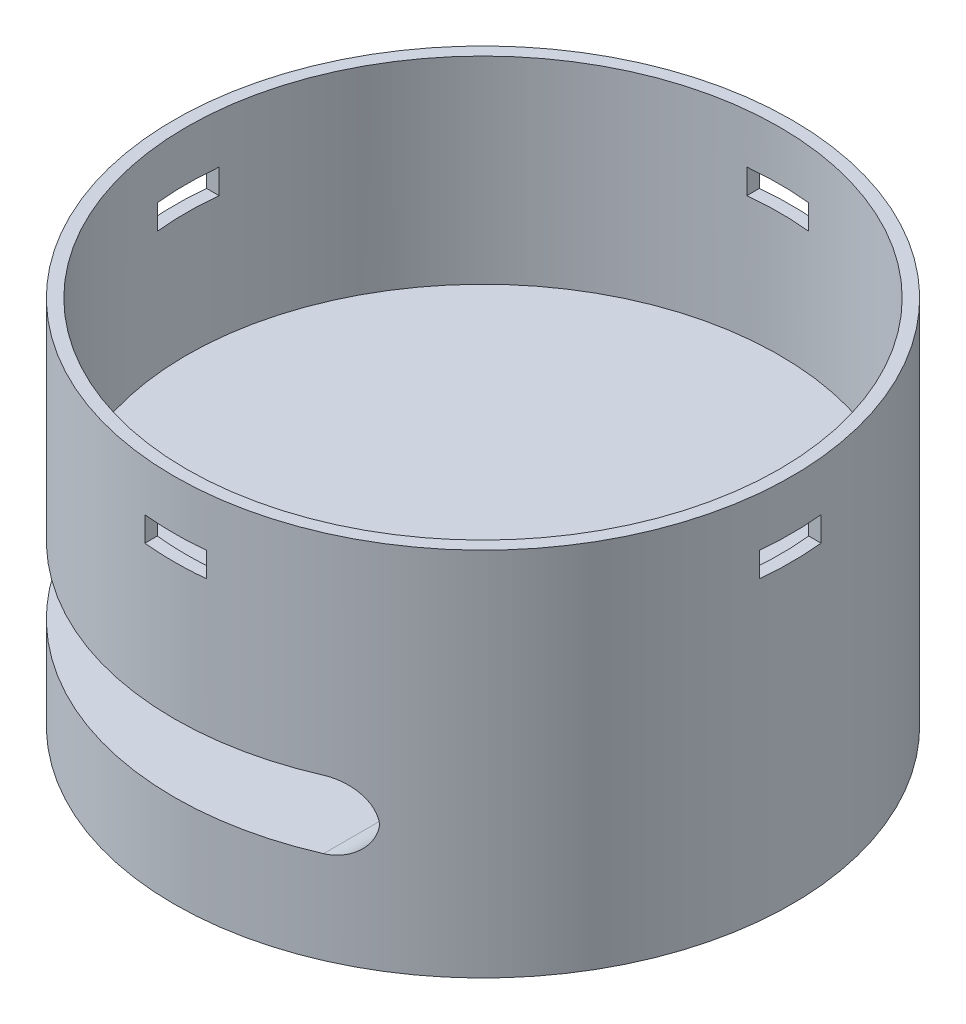
from build123d import *

# Parameters (mm, degrees)
SKETCH2_R                      = 250
BOSS_EXTRUDE1_DEPTH            = 300
CUT_EXTRUDE1_DEPTH             = 464.680924775
CUT_EXTRUDE1_DEPTH_BACK        = 464.680924775
SKETCH3_W                      = 380
SKETCH3_H                      = 55
SHELL1_START                   = 140
SHELL1_OUTLINE_R               = 240
SHELL1_DEPTH                   = 150
SHELL1_START_2                 = 10
SHELL1_2_OUTLINE_R             = 240
SHELL1_2_DEPTH                 = 55
SHELL1_START_3                 = 65
SHELL1_3_DEPTH                 = 75
CUT_EXTRUDE2_REACH             = 546.885
SKETCH4_W                      = 120
SKETCH4_H                      = 20
CUT_EXTRUDE5_START             = -20
SKETCH6_R                      = 240
CUT_EXTRUDE5_DEPTH             = 20
CUT_EXTRUDE6_REACH             = 465.681
SKETCH8_3_W                    = 50
SKETCH8_3_H                    = 20
CUT_EXTRUDE6_DIRECTION_2_DEPTH = 464.680924775
CIRPATTERN1_COUNT              = 2
CIRPATTERN1_ANGLE              = 90
FILLET2_R                      = 30


# Read off the part's stored shape, not the designer's step: Shell1
with BuildPart() as part:
    # Sketch2 → Boss-Extrude1 (new body)
    with BuildSketch(Plane(origin=(0, 0, 0), x_dir=(1, 0, 0), z_dir=(0, 1, 0))):
        with Locations(Location((0, 0, 0), (0, 0, 270))):
            Circle(SKETCH2_R)
    extrude(amount=BOSS_EXTRUDE1_DEPTH)

    # Sketch3 → Cut-Extrude1 (cut, two sides: drawn at the far end of the back side and taken through both)
    with BuildSketch(Plane.XY.offset(-CUT_EXTRUDE1_DEPTH_BACK)):
        with Locations((-60, 102.5)):
            Rectangle(SKETCH3_W, SKETCH3_H)
    extrude(amount=CUT_EXTRUDE1_DEPTH + CUT_EXTRUDE1_DEPTH_BACK, mode=Mode.SUBTRACT)

    # Shell1 outline → Shell1 (cut)
    with BuildSketch(Plane(origin=(0, 0, 0), x_dir=(1, 0, 0), z_dir=(0, 1, 0)).offset(SHELL1_START)):
        Circle(SHELL1_OUTLINE_R)
    extrude(amount=SHELL1_DEPTH, mode=Mode.SUBTRACT)

    # Shell1 2 outline → Shell1 2 (cut)
    with BuildSketch(Plane(origin=(0, 0, 0), x_dir=(1, 0, 0), z_dir=(0, 1, 0)).offset(SHELL1_START_2)):
        Circle(SHELL1_2_OUTLINE_R)
    extrude(amount=SHELL1_2_DEPTH, mode=Mode.SUBTRACT)

    # Shell1 3 outline → Shell1 3 (cut)
    with BuildSketch(Plane(origin=(0, 0, 0), x_dir=(1, 0, 0), z_dir=(0, 1, 0)).offset(SHELL1_START_3)):
        with BuildLine():
            ThreePointArc((140, -194.935886896), (240, 0), (140, 194.935886896))
            Line((140, 194.935886896), (140, -194.935886896))
        make_face()
    extrude(amount=SHELL1_3_DEPTH, mode=Mode.SUBTRACT)

    # Sketch4 → Cut-Extrude2 (cut, up to next)
    with BuildSketch(Plane.ZY.offset(-130), mode=Mode.PRIVATE) as cut_extrude2_sk1:
        with Locations((0, 102.5)):
            Rectangle(SKETCH4_W, SKETCH4_H)
    cut_extrude2_tool1 = extrude(cut_extrude2_sk1.sketch, amount=-CUT_EXTRUDE2_REACH, mode=Mode.PRIVATE) & part.part
    add(cut_extrude2_tool1.solids().sort_by_distance((130, 102.5, 0))[0], mode=Mode.SUBTRACT)

    # Sketch6 → Cut-Extrude5 (cut)
    with BuildSketch(Plane(origin=(0, 300, 0), x_dir=(1, 0, 0), z_dir=(0, 1, 0)).offset(CUT_EXTRUDE5_START)):
        with Locations(Location((0, 0, 0), (0, 0, 270))):
            Circle(SKETCH6_R)
    extrude(amount=CUT_EXTRUDE5_DEPTH, mode=Mode.SUBTRACT)

    # Sketch8<3> → Cut-Extrude6 (cut, up to next)
    with BuildSketch(Plane(origin=(0, 0, 0), x_dir=(0, 0, -1), z_dir=(1, 0, 0)), mode=Mode.PRIVATE) as cut_extrude6_sk1:
        with Locations((0, 250)):
            Rectangle(SKETCH8_3_W, SKETCH8_3_H)
    cut_extrude6_tool1 = extrude(cut_extrude6_sk1.sketch, amount=-CUT_EXTRUDE6_REACH, mode=Mode.PRIVATE) & part.part
    cut_extrude6 = cut_extrude6_tool1.solids().sort_by_distance((0, 250, 0))[0]
    add(cut_extrude6, mode=Mode.SUBTRACT)

    # Sketch8<3> → Cut-Extrude6 direction 2 (cut)
    with BuildSketch(Plane(origin=(0, 0, 0), x_dir=(0, 0, -1), z_dir=(1, 0, 0))):
        with Locations((0, 250)):
            Rectangle(SKETCH8_3_W, SKETCH8_3_H)
    cut_extrude6_direction_2 = extrude(amount=CUT_EXTRUDE6_DIRECTION_2_DEPTH, mode=Mode.SUBTRACT)

    # CirPattern1: Cut-Extrude6, Cut-Extrude6 direction 2 ×2 about axis
    cirpattern1_axis = Axis((0, 300, 0), (0, 1, 0))
    add([cut_extrude6.rotate(cirpattern1_axis, i * CIRPATTERN1_ANGLE / (CIRPATTERN1_COUNT - 1)) for i in range(1, CIRPATTERN1_COUNT)], mode=Mode.SUBTRACT)
    add([cut_extrude6_direction_2.rotate(cirpattern1_axis, i * CIRPATTERN1_ANGLE / (CIRPATTERN1_COUNT - 1)) for i in range(1, CIRPATTERN1_COUNT)], mode=Mode.SUBTRACT)

    # Fillet2
    # the kernel refuses this fillet: 30 mm, written as the material it adds along each edge
    with BuildSketch(Plane(origin=(130, 130, -288.541565041), x_dir=(0, -1, 0), z_dir=(0, 0, 1))) as fillet2_piece_1_section:
        with BuildLine():
            CenterArc((FILLET2_R, -FILLET2_R), FILLET2_R, 90, 90)
            Line((0, -FILLET2_R), (0, 0))
            Line((0, 0), (FILLET2_R, 0))
        make_face()
    fillet2_piece_1 = extrude(amount=577.083130081, mode=Mode.PRIVATE)
    fillet2_piece_1 = fillet2_piece_1 & Plane(origin=(0, 108.141191738, 0), x_dir=(0, 0, 1), z_dir=(0, -1, 0)) * Cylinder(250, 1275, mode=Mode.PRIVATE)
    fillet2_piece_1 = split(fillet2_piece_1, bisect_by=Plane(origin=(129.633192853, 108.141191738, -60), z_dir=(0, 0, -1)), keep=Keep.TOP, mode=Mode.PRIVATE)
    fillet2_piece_1 = split(fillet2_piece_1, bisect_by=Plane(origin=(129.633192853, 112.5, -136.881350588), z_dir=(0, -1, 0)), keep=Keep.TOP, mode=Mode.PRIVATE)
    add(fillet2_piece_1)
    with BuildSketch(Plane(origin=(130, 130, -288.541565041), x_dir=(0, -1, 0), z_dir=(0, 0, 1))) as fillet2_piece_2_section:
        with BuildLine():
            CenterArc((FILLET2_R, -FILLET2_R), FILLET2_R, 90, 90)
            Line((0, -FILLET2_R), (0, 0))
            Line((0, 0), (FILLET2_R, 0))
        make_face()
    fillet2_piece_2 = extrude(amount=577.083130081, mode=Mode.PRIVATE)
    fillet2_piece_2 = fillet2_piece_2 & Plane(origin=(0, 124.602125162, 0), x_dir=(0, 0, 1), z_dir=(0, -1, 0)) * Cylinder(250, 1275, mode=Mode.PRIVATE)
    fillet2_piece_2 = split(fillet2_piece_2, bisect_by=Plane(origin=(122.496617269, 124.602125162, -60), z_dir=(0, 0, -1)), keep=Keep.TOP, mode=Mode.PRIVATE)
    fillet2_piece_2 = split(fillet2_piece_2, bisect_by=Plane(origin=(122.496617269, 112.5, -138.903095836), z_dir=(0, 1, 0)), keep=Keep.TOP, mode=Mode.PRIVATE)
    add(fillet2_piece_2)
    with BuildSketch(Plane(origin=(130, 130, -288.541565041), x_dir=(0, -1, 0), z_dir=(0, 0, 1))) as fillet2_piece_3_section:
        with BuildLine():
            CenterArc((FILLET2_R, -FILLET2_R), FILLET2_R, 90, 90)
            Line((0, -FILLET2_R), (0, 0))
            Line((0, 0), (FILLET2_R, 0))
        make_face()
    fillet2_piece_3 = extrude(amount=577.083130081, mode=Mode.PRIVATE)
    fillet2_piece_3 = split(fillet2_piece_3, bisect_by=Plane(origin=(122.639576661, 124.541490092, -60), z_dir=(0, 0, 1)), keep=Keep.TOP, mode=Mode.PRIVATE)
    fillet2_piece_3 = split(fillet2_piece_3, bisect_by=Plane(origin=(122.639576661, 124.541490092, 60), z_dir=(0, 0, -1)), keep=Keep.TOP, mode=Mode.PRIVATE)
    fillet2_piece_3 = split(fillet2_piece_3, bisect_by=Plane(origin=(122.639576661, 112.5, 0), z_dir=(0, 1, 0)), keep=Keep.TOP, mode=Mode.PRIVATE)
    add(fillet2_piece_3)
    with BuildSketch(Plane(origin=(130, 130, -288.541565041), x_dir=(0, -1, 0), z_dir=(0, 0, 1))) as fillet2_piece_4_section:
        with BuildLine():
            CenterArc((FILLET2_R, -FILLET2_R), FILLET2_R, 90, 90)
            Line((0, -FILLET2_R), (0, 0))
            Line((0, 0), (FILLET2_R, 0))
        make_face()
    fillet2_piece_4 = extrude(amount=577.083130081, mode=Mode.PRIVATE)
    fillet2_piece_4 = fillet2_piece_4 & Plane(origin=(0, 108.141191737, 0), x_dir=(0, 0, 1), z_dir=(0, -1, 0)) * Cylinder(250, 1275, mode=Mode.PRIVATE)
    fillet2_piece_4 = split(fillet2_piece_4, bisect_by=Plane(origin=(129.633192853, 108.141191737, 60), z_dir=(0, 0, 1)), keep=Keep.TOP, mode=Mode.PRIVATE)
    fillet2_piece_4 = split(fillet2_piece_4, bisect_by=Plane(origin=(129.633192853, 112.5, 136.881350585), z_dir=(0, -1, 0)), keep=Keep.TOP, mode=Mode.PRIVATE)
    add(fillet2_piece_4)
    with BuildSketch(Plane(origin=(130, 130, -288.541565041), x_dir=(0, -1, 0), z_dir=(0, 0, 1))) as fillet2_piece_5_section:
        with BuildLine():
            CenterArc((FILLET2_R, -FILLET2_R), FILLET2_R, 90, 90)
            Line((0, -FILLET2_R), (0, 0))
            Line((0, 0), (FILLET2_R, 0))
        make_face()
    fillet2_piece_5 = extrude(amount=577.083130081, mode=Mode.PRIVATE)
    fillet2_piece_5 = fillet2_piece_5 & Plane(origin=(0, 124.602106632, 0), x_dir=(0, 0, 1), z_dir=(0, -1, 0)) * Cylinder(250, 1275, mode=Mode.PRIVATE)
    fillet2_piece_5 = split(fillet2_piece_5, bisect_by=Plane(origin=(122.496572682, 124.602106632, 60), z_dir=(0, 0, 1)), keep=Keep.TOP, mode=Mode.PRIVATE)
    fillet2_piece_5 = split(fillet2_piece_5, bisect_by=Plane(origin=(122.496572682, 112.5, 138.903516263), z_dir=(0, 1, 0)), keep=Keep.TOP, mode=Mode.PRIVATE)
    add(fillet2_piece_5)
    with BuildSketch(Plane(origin=(130, 75, -288.541565041), x_dir=(-1, 0, 0), z_dir=(0, 0, 1))) as fillet2_piece_6_section:
        with BuildLine():
            CenterArc((FILLET2_R, -FILLET2_R), FILLET2_R, 90, 90)
            Line((0, -FILLET2_R), (0, 0))
            Line((0, 0), (FILLET2_R, 0))
        make_face()
    fillet2_piece_6 = extrude(amount=577.083130081, mode=Mode.PRIVATE)
    fillet2_piece_6 = fillet2_piece_6 & Plane(origin=(0, 80.397884307, 0), x_dir=(0, 0, 1), z_dir=(0, -1, 0)) * Cylinder(250, 1275, mode=Mode.PRIVATE)
    fillet2_piece_6 = split(fillet2_piece_6, bisect_by=Plane(origin=(122.496621968, 80.397884307, -60), z_dir=(0, 0, -1)), keep=Keep.TOP, mode=Mode.PRIVATE)
    fillet2_piece_6 = split(fillet2_piece_6, bisect_by=Plane(origin=(122.496621968, 92.5, -138.903256412), z_dir=(0, -1, 0)), keep=Keep.TOP, mode=Mode.PRIVATE)
    add(fillet2_piece_6)
    with BuildSketch(Plane(origin=(130, 75, -288.541565041), x_dir=(-1, 0, 0), z_dir=(0, 0, 1))) as fillet2_piece_7_section:
        with BuildLine():
            CenterArc((FILLET2_R, -FILLET2_R), FILLET2_R, 90, 90)
            Line((0, -FILLET2_R), (0, 0))
            Line((0, 0), (FILLET2_R, 0))
        make_face()
    fillet2_piece_7 = extrude(amount=577.083130081, mode=Mode.PRIVATE)
    fillet2_piece_7 = fillet2_piece_7 & Plane(origin=(0, 96.858808254, 0), x_dir=(0, 0, 1), z_dir=(0, -1, 0)) * Cylinder(250, 1275, mode=Mode.PRIVATE)
    fillet2_piece_7 = split(fillet2_piece_7, bisect_by=Plane(origin=(129.633192853, 96.858808254, -60), z_dir=(0, 0, -1)), keep=Keep.TOP, mode=Mode.PRIVATE)
    fillet2_piece_7 = split(fillet2_piece_7, bisect_by=Plane(origin=(129.633192853, 92.5, -136.881350463), z_dir=(0, 1, 0)), keep=Keep.TOP, mode=Mode.PRIVATE)
    add(fillet2_piece_7)
    with BuildSketch(Plane(origin=(130, 75, -288.541565041), x_dir=(-1, 0, 0), z_dir=(0, 0, 1))) as fillet2_piece_8_section:
        with BuildLine():
            CenterArc((FILLET2_R, -FILLET2_R), FILLET2_R, 90, 90)
            Line((0, -FILLET2_R), (0, 0))
            Line((0, 0), (FILLET2_R, 0))
        make_face()
    fillet2_piece_8 = extrude(amount=577.083130081, mode=Mode.PRIVATE)
    fillet2_piece_8 = split(fillet2_piece_8, bisect_by=Plane(origin=(122.639576661, 80.458509908, -60), z_dir=(0, 0, 1)), keep=Keep.TOP, mode=Mode.PRIVATE)
    fillet2_piece_8 = split(fillet2_piece_8, bisect_by=Plane(origin=(122.639576661, 92.5, 0), z_dir=(0, -1, 0)), keep=Keep.TOP, mode=Mode.PRIVATE)
    fillet2_piece_8 = split(fillet2_piece_8, bisect_by=Plane(origin=(122.639576661, 80.458509908, 60), z_dir=(0, 0, -1)), keep=Keep.TOP, mode=Mode.PRIVATE)
    add(fillet2_piece_8)
    with BuildSketch(Plane(origin=(130, 75, -288.541565041), x_dir=(-1, 0, 0), z_dir=(0, 0, 1))) as fillet2_piece_9_section:
        with BuildLine():
            CenterArc((FILLET2_R, -FILLET2_R), FILLET2_R, 90, 90)
            Line((0, -FILLET2_R), (0, 0))
            Line((0, 0), (FILLET2_R, 0))
        make_face()
    fillet2_piece_9 = extrude(amount=577.083130081, mode=Mode.PRIVATE)
    fillet2_piece_9 = fillet2_piece_9 & Plane(origin=(0, 80.397869734, 0), x_dir=(0, 0, 1), z_dir=(0, -1, 0)) * Cylinder(250, 1275, mode=Mode.PRIVATE)
    fillet2_piece_9 = split(fillet2_piece_9, bisect_by=Plane(origin=(122.496641232, 92.5, 138.903074765), z_dir=(0, -1, 0)), keep=Keep.TOP, mode=Mode.PRIVATE)
    fillet2_piece_9 = split(fillet2_piece_9, bisect_by=Plane(origin=(122.496641232, 80.397869734, 60), z_dir=(0, 0, 1)), keep=Keep.TOP, mode=Mode.PRIVATE)
    add(fillet2_piece_9)
    with BuildSketch(Plane(origin=(130, 75, -288.541565041), x_dir=(-1, 0, 0), z_dir=(0, 0, 1))) as fillet2_piece_10_section:
        with BuildLine():
            CenterArc((FILLET2_R, -FILLET2_R), FILLET2_R, 90, 90)
            Line((0, -FILLET2_R), (0, 0))
            Line((0, 0), (FILLET2_R, 0))
        make_face()
    fillet2_piece_10 = extrude(amount=577.083130081, mode=Mode.PRIVATE)
    fillet2_piece_10 = fillet2_piece_10 & Plane(origin=(0, 96.858808255, 0), x_dir=(0, 0, 1), z_dir=(0, -1, 0)) * Cylinder(250, 1275, mode=Mode.PRIVATE)
    fillet2_piece_10 = split(fillet2_piece_10, bisect_by=Plane(origin=(129.633192854, 92.5, 136.881350462), z_dir=(0, 1, 0)), keep=Keep.TOP, mode=Mode.PRIVATE)
    fillet2_piece_10 = split(fillet2_piece_10, bisect_by=Plane(origin=(129.633192854, 96.858808255, 60), z_dir=(0, 0, 1)), keep=Keep.TOP, mode=Mode.PRIVATE)
    add(fillet2_piece_10)


solid = part.part
